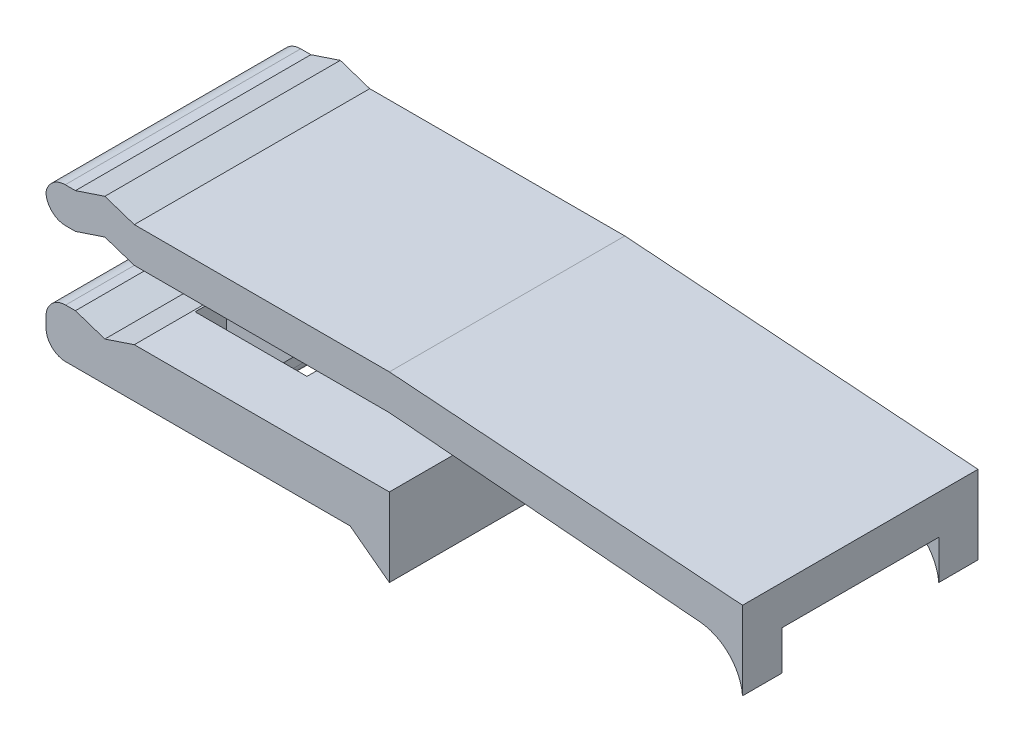
from build123d import *

# Parameters (mm, degrees)
BOSS_EXTRUDE1_DEPTH   = 12
BOSS_EXTRUDE1_2_DEPTH = 12
SKETCH2_W             = 5.7
SKETCH2_H             = 6
CUT_EXTRUDE1_DEPTH    = 3
BOSS_EXTRUDE2_DEPTH   = 6
BOSS_EXTRUDE3_START   = -6
BOSS_EXTRUDE3_DEPTH   = 2.5
FILLET7_R             = 1
FILLET8_R             = 1
FILLET10_R            = 1
FILLET11_R            = 1
BOSS_EXTRUDE4_DEPTH   = 2
BOSS_EXTRUDE5_START   = -10
BOSS_EXTRUDE5_DEPTH   = 2
FILLET12_R            = 0.5


with BuildPart() as part:
    # Sketch1 → Boss-Extrude1 (new body)
    with BuildSketch(Plane.XY):
        Polygon((0, 4), (-18, 5.3), (-31, 5.3), (-32.5, 5.8), (-34, 5.3), (-35.5, 5.3), (-35.5, 3.5), (-34, 3.5), (-32.5, 4), (-31, 3.5), (-18, 3.5), (0, 2), align=None)
    extrude(amount=BOSS_EXTRUDE1_DEPTH)

    # Sketch4 → Boss-Extrude3 (add, symmetric)
    with BuildSketch(Plane.XY.offset(12).offset(BOSS_EXTRUDE3_START)):
        with BuildLine():
            Line((-28.4, -2), (-26.4, 0))
            Line((-26.4, 0), (-26.4, 0.4))
            Line((-26.4, 0.4), (-27.9, 0.4))
            Line((-27.9, 0.4), (-27.9, 1.9))
            ThreePointArc((-27.9, 1.9), (-27.43137085, 3.03137085), (-26.3, 3.5))
            Line((-26.3, 3.5), (-29.8, 3.5))
            Line((-29.8, 3.5), (-29.8, -3))
            Line((-29.8, -3), (-28.4, -3))
            Line((-28.4, -3), (-28.4, -2))
        make_face()
    extrude(amount=BOSS_EXTRUDE3_DEPTH, both=True)

    # Fillet8
    fillet8_edges = [part.edges().sort_by_distance(p)[0] for p in [
        (-35.5, 3.5, 6),
    ]]
    fillet(fillet8_edges, radius=FILLET8_R)

    # Fillet10
    # the kernel refuses this fillet: 1 mm, written as the material it takes off along each edge
    with BuildSketch(Plane(origin=(-35.5, 5.3, -2.449489743), x_dir=(1.545430450277731e-12, -1.0, 0), z_dir=(0, 0, 1))) as fillet10_piece_1:
        with BuildLine():
            CenterArc((1, 0.979795897), FILLET10_R, 180, 78.463040967)
            Line((0, 0.979795897), (-0.02, 0.979795897))
            Line((-0.02, 0.979795897), (-0.02, 0))
            Line((-0.02, 0), (0, -0.02))
            ThreePointArc((0, -0.02), (0.4, -0.02), (0.796, -0.019595918))
            Line((0.796, -0.019595918), (0.8, 0))
        make_face()
    extrude(amount=16.898979486, mode=Mode.SUBTRACT)

    # Sketch5 → Boss-Extrude4 (add)
    with BuildSketch(Plane.XY.offset(12)):
        with BuildLine():
            Line((0, 2), (0, 0))
            ThreePointArc((0, 0), (-0.691300526, 1.490517656), (-2.181818182, 2.181818182))
            Line((-2.181818182, 2.181818182), (0, 2))
        make_face()
    extrude(amount=-BOSS_EXTRUDE4_DEPTH)

    # Sketch5<2> → Boss-Extrude5 (add)
    with BuildSketch(Plane.XY.offset(12).offset(BOSS_EXTRUDE5_START)):
        with BuildLine():
            Line((0, 2), (0, 0))
            ThreePointArc((0, 0), (-0.691300526, 1.490517656), (-2.181818182, 2.181818182))
            Line((-2.181818182, 2.181818182), (0, 2))
        make_face()
    extrude(amount=-BOSS_EXTRUDE5_DEPTH)

    # Fillet12
    fillet12_edges = [part.edges().sort_by_distance(p)[0] for p in [
        (-28.4, -3, 6),
        (-29.8, -3, 6),
    ]]
    fillet(fillet12_edges, radius=FILLET12_R)


with BuildPart() as body_2:
    # Sketch1 → Boss-Extrude1 2 (new body)
    with BuildSketch(Plane.XY):
        Polygon((-35.5, -2.5), (-20, -2.5), (-18, -4), (-18, 0), (-31, 0), (-32.5, -0.5), (-34, 0), (-35.5, 0), align=None)
    extrude(amount=BOSS_EXTRUDE1_2_DEPTH)

    # Sketch2 → Cut-Extrude1 (cut)
    with BuildSketch(Plane.XZ.offset(2.5)):
        with Locations((-28.05, 6)):
            Rectangle(SKETCH2_W, SKETCH2_H)
    extrude(amount=-CUT_EXTRUDE1_DEPTH, mode=Mode.SUBTRACT)

    # Sketch3 → Boss-Extrude2 (add)
    with BuildSketch(Plane.XY.offset(3)):
        Polygon((-25.2, 0), (-27.2, -2), (-27.2, -2.5), (-25.2, -2.5), align=None)
    extrude(amount=BOSS_EXTRUDE2_DEPTH)

    # Fillet7
    fillet7_edges = [body_2.edges().sort_by_distance(p)[0] for p in [
        (-35.5, 0, 6),
    ]]
    fillet(fillet7_edges, radius=FILLET7_R)

    # Fillet11
    fillet11_edges = [body_2.edges().sort_by_distance(p)[0] for p in [
        (-35.5, -2.5, 6),
    ]]
    fillet(fillet11_edges, radius=FILLET11_R)


solid = Compound([part.part, body_2.part])
